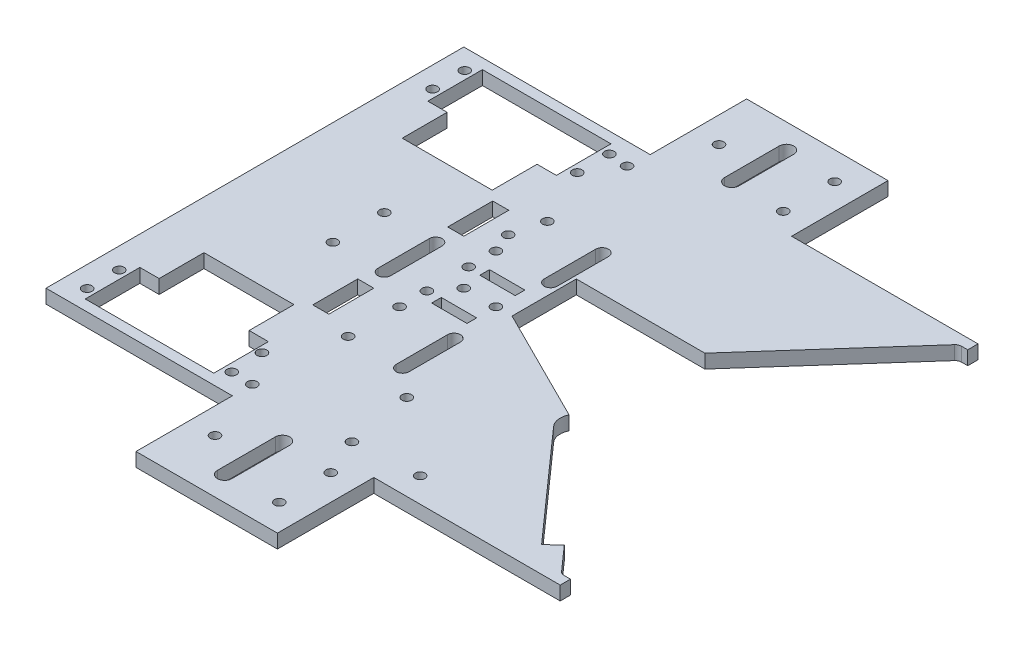
from build123d import *

# Parameters (mm, degrees)
BOSS_EXTRUDE1_DEPTH = 4.3
CUT_EXTRUDE1_DEPTH  = 4.5
FILLET1_R           = 2
CUT_EXTRUDE2_DEPTH  = 10
SKETCH8_R           = 1.5
CUT_EXTRUDE3_DEPTH  = 10
SKETCH9_R           = 1.5
CUT_EXTRUDE4_DEPTH  = 10
CUT_EXTRUDE5_DEPTH  = 10
SKETCH11_R          = 1.5
CUT_EXTRUDE6_DEPTH  = 10
SKETCH12_R          = 1.5
CUT_EXTRUDE7_DEPTH  = 10
SKETCH7_R           = 1.5
SKETCH7_W           = 11
SKETCH7_H           = 3
CUT_EXTRUDE8_DEPTH  = 9
SKETCH13_R          = 1.5
CUT_EXTRUDE9_DEPTH  = 10
SKETCH14_R          = 1.5
CUT_EXTRUDE10_DEPTH = 10
SKETCH15_W          = 5
SKETCH15_H          = 14
CUT_EXTRUDE11_DEPTH = 10
SKETCH16_R          = 1.5
CUT_EXTRUDE12_DEPTH = 10


with BuildPart() as part:
    # Sketch2 → Boss-Extrude1 (new body)
    with BuildSketch(Plane(origin=(0, 0, 0), x_dir=(1, 0, 0), z_dir=(0, 1, 0))):
        Polygon((0, 0), (0, 65), (58, 65), (58, 95), (102, 95), (102, 65), (160, 65), (160, 0), align=None)
    extrude(amount=BOSS_EXTRUDE1_DEPTH)

    # Mirror1: part across plane


with BuildPart() as part_1:
    add(part.part)
    add(part.part.mirror(Plane(origin=(0, 4.3, 0), x_dir=(1, 0, 0), z_dir=(0, 0, -1))))

    # Sketch3 → Cut-Extrude1 (cut)
    with BuildSketch(Plane(origin=(0, 4.3, 0), x_dir=(1, 0, 0), z_dir=(0, 1, 0))):
        Polygon((160, -61.8), (160, 61.8), (157.156451185, 61.8), (120.012594795, 20), (80.012594795, 20), (80.012594795, 0), (120, -20), (157.155555556, -61.8), align=None)
    extrude(amount=-CUT_EXTRUDE1_DEPTH, mode=Mode.SUBTRACT)

    # Fillet1
    fillet1_edges = [part_1.edges().sort_by_distance(p)[0] for p in [
        (157.156451185, 2.15, -61.8),
        (157.155555556, 2.15, 61.8),
    ]]
    fillet(fillet1_edges, radius=FILLET1_R)

    # Sketch6 → Cut-Extrude2 (cut)
    with BuildSketch(Plane(origin=(0, 4.3, 0), x_dir=(1, 0, 0), z_dir=(0, 1, 0))):
        Polygon((9, -61.8), (49, -61.8), (49, -44.8), (43, -44.8), (43, -30.841820122), (15, -30.841820122), (15, -44.8), (9, -44.8), align=None)
        Polygon((9, 44.8), (15, 44.8), (15, 30.841820122), (43, 30.841820122), (43, 44.8), (49, 44.8), (49, 61.8), (9, 61.8), align=None)
    extrude(amount=-CUT_EXTRUDE2_DEPTH, mode=Mode.SUBTRACT)

    # Sketch8 → Cut-Extrude3 (cut)
    with BuildSketch(Plane(origin=(0, 4.3, 0), x_dir=(1, 0, 0), z_dir=(0, 1, 0))):
        with Locations((6.5, 58.8)):
            Circle(SKETCH8_R)
        with Locations((6.5, 48.8)):
            Circle(SKETCH8_R)
        with Locations((51.5, 48.8)):
            Circle(SKETCH8_R)
        with Locations((51.5, 58.8)):
            Circle(SKETCH8_R)
        with Locations((6.5, -48.7)):
            Circle(SKETCH8_R)
        with Locations((6.5, -58.7)):
            Circle(SKETCH8_R)
        with Locations((51.5, -58.7)):
            Circle(SKETCH8_R)
        with Locations((51, -48.8)):
            Circle(SKETCH8_R)
    extrude(amount=-CUT_EXTRUDE3_DEPTH, mode=Mode.SUBTRACT)

    # Sketch9 → Cut-Extrude4 (cut)
    with BuildSketch(Plane.XZ):
        with Locations((94, 70.4)):
            Circle(SKETCH9_R)
        with Locations((66, 78.4)):
            Circle(SKETCH9_R)
        with Locations((66, -78.4)):
            Circle(SKETCH9_R)
        with Locations((94, -86.4)):
            Circle(SKETCH9_R)
        with Locations((94, 86.4)):
            Circle(SKETCH9_R)
        with Locations((94, -70.4)):
            Circle(SKETCH9_R)
        with BuildLine():
            Line((75.75, 69.4), (75.75, 87.4))
            ThreePointArc((75.75, 87.4), (78, 89.65), (80.25, 87.4))
            Line((80.25, 87.4), (80.25, 69.4))
            ThreePointArc((80.25, 69.4), (78, 67.15), (75.75, 69.4))
        make_face()
        with BuildLine():
            Line((75.75, -87.4), (75.75, -70.4))
            ThreePointArc((75.75, -70.4), (78, -68.15), (80.25, -70.4))
            Line((80.25, -70.4), (80.25, -87.4))
            ThreePointArc((80.25, -87.4), (78, -89.65), (75.75, -87.4))
        make_face()
    extrude(amount=-CUT_EXTRUDE4_DEPTH, mode=Mode.SUBTRACT)

    # Sketch10 → Cut-Extrude5 (cut)
    with BuildSketch(Plane(origin=(0, 4.3, 0), x_dir=(1, 0, 0), z_dir=(0, 1, 0))):
        with BuildLine():
            Line((123.321819194, -23.737046593), (149.896372747, -53.633419341))
            Line((149.896372747, -53.633419341), (146.159326154, -56.955238535))
            Line((146.159326154, -56.955238535), (116.262953407, -23.321819194))
            ThreePointArc((116.262953407, -23.321819194), (120.29361011, -15.008628134), (123.321819194, -23.737046593))
        make_face()
    extrude(amount=-CUT_EXTRUDE5_DEPTH, mode=Mode.SUBTRACT)

    # Sketch11 → Cut-Extrude6 (cut)
    with BuildSketch(Plane.XZ):
        with BuildLine():
            ThreePointArc((79, 31.031280577), (77, 33.031280577), (75, 31.031280577))
            Line((75, 31.031280577), (75, 15.031280577))
            ThreePointArc((75, 15.031280577), (77, 13.031280577), (79, 15.031280577))
            Line((79, 15.031280577), (79, 31.031280577))
        make_face()
        with BuildLine():
            ThreePointArc((75, -31.031280577), (77, -33.031280577), (79, -31.031280577))
            Line((79, -31.031280577), (79, -15.031280577))
            ThreePointArc((79, -15.031280577), (77, -13.031280577), (75, -15.031280577))
            Line((75, -15.031280577), (75, -31.031280577))
        make_face()
        with Locations((60, 31)):
            Circle(SKETCH11_R)
        with Locations((60, 15)):
            Circle(SKETCH11_R)
        with Locations((60, -15)):
            Circle(SKETCH11_R)
        with Locations((60, -31)):
            Circle(SKETCH11_R)
    extrude(amount=-CUT_EXTRUDE6_DEPTH, mode=Mode.SUBTRACT)

    # Sketch12 → Cut-Extrude7 (cut)
    with BuildSketch(Plane(origin=(0, 0, 0), x_dir=(-1, 0, 0), z_dir=(0, -1, 0))):
        with BuildLine():
            ThreePointArc((-50.262723036, -8), (-48.262723036, -10), (-46.262723036, -8))
            Line((-46.262723036, -8), (-46.262723036, 8))
            ThreePointArc((-46.262723036, 8), (-48.262723036, 10), (-50.262723036, 8))
            Line((-50.262723036, 8), (-50.262723036, -8))
        make_face()
        with Locations((-32.262723036, -8)):
            Circle(SKETCH12_R)
        with Locations((-32.262723036, 8)):
            Circle(SKETCH12_R)
    extrude(amount=-CUT_EXTRUDE7_DEPTH, mode=Mode.SUBTRACT)

    # Sketch7 → Cut-Extrude8 (cut)
    with BuildSketch(Plane(origin=(0, 4.3, 0), x_dir=(1, 0, 0), z_dir=(0, 1, 0))):
        with Locations((60.012594795, -6.5)):
            Circle(SKETCH7_R)
        with Locations((60.012594795, 6.5)):
            Circle(SKETCH7_R)
        with Locations((69.5, -7.5)):
            Rectangle(SKETCH7_W, SKETCH7_H)
        with Locations((69.5, 7.5)):
            Rectangle(SKETCH7_W, SKETCH7_H)
    extrude(amount=-CUT_EXTRUDE8_DEPTH, mode=Mode.SUBTRACT)

    # Sketch13 → Cut-Extrude9 (cut)
    with BuildSketch(Plane(origin=(0, 4.3, 0), x_dir=(1, 0, 0), z_dir=(0, 1, 0))):
        with Locations((75, 0)):
            Circle(SKETCH13_R)
        with Locations((65, 0)):
            Circle(SKETCH13_R)
    extrude(amount=-CUT_EXTRUDE9_DEPTH, mode=Mode.SUBTRACT)

    # Sketch14 → Cut-Extrude10 (cut)
    with BuildSketch(Plane(origin=(0, 4.3, 0), x_dir=(1, 0, 0), z_dir=(0, 1, 0))):
        with Locations((57.5, 58.3)):
            Circle(SKETCH14_R)
        with Locations((57.5, 21.3)):
            Circle(SKETCH14_R)
        with Locations((85.565271793, -38.309819587)):
            Circle(SKETCH14_R)
        with Locations((108.754116531, -57.343407785)):
            Circle(SKETCH14_R)
    extrude(amount=-CUT_EXTRUDE10_DEPTH, mode=Mode.SUBTRACT)

    # Sketch15 → Cut-Extrude11 (cut)
    with BuildSketch(Plane(origin=(0, 4.3, 0), x_dir=(1, 0, 0), z_dir=(0, 1, 0))):
        with Locations((48.5, 21)):
            Rectangle(SKETCH15_W, SKETCH15_H)
        with Locations((48.5, -21)):
            Rectangle(SKETCH15_W, SKETCH15_H)
    extrude(amount=-CUT_EXTRUDE11_DEPTH, mode=Mode.SUBTRACT)

    # Sketch16 → Cut-Extrude12 (cut)
    with BuildSketch(Plane(origin=(0, 4.3, 0), x_dir=(1, 0, 0), z_dir=(0, 1, 0))):
        with Locations((89, -58.8)):
            Circle(SKETCH16_R)
        with Locations((58, -58.8)):
            Circle(SKETCH16_R)
    extrude(amount=-CUT_EXTRUDE12_DEPTH, mode=Mode.SUBTRACT)


solid = part_1.part
